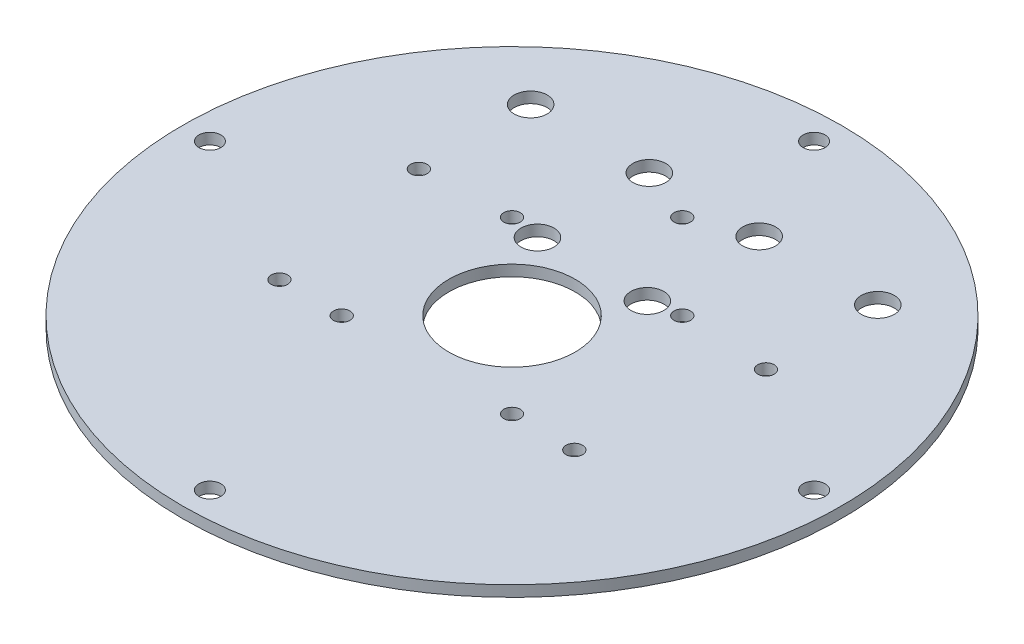
from build123d import *

# Parameters (mm, degrees)
SKETCH_1_R          = 60
SKETCH_1_R_2        = 1.5
EXTRUDE_1_DEPTH     = 2
SKETCH_3_R          = 11.5
CUT_EXTRUDE_3_DEPTH = 2
SKETCH_4_R          = 1.5
CUT_EXTRUDE_4_DEPTH = 2
SKETCH_5_R          = 3
CUT_EXTRUDE_5_DEPTH = 10
SKETCH_6_R          = 2
CUT_EXTRUDE_6_DEPTH = 10
SKETCH_7_R          = 3
CUT_EXTRUDE_7_DEPTH = 10
SKETCH_8_R          = 3
CUT_EXTRUDE_8_DEPTH = 10
SKETCH_9_R          = 1.5
CUT_EXTRUDE_9_DEPTH = 10


with BuildPart() as part:
    # 草图1 → 凸台-拉伸1 (new body)
    with BuildSketch(Plane(origin=(0, 0, 0), x_dir=(1, 0, 0), z_dir=(0, 1, 0))):
        Circle(SKETCH_1_R)
        with Locations((0, 31)):
            Circle(SKETCH_1_R_2, mode=Mode.SUBTRACT)
        with Locations((26.846787517, -15.5)):
            Circle(SKETCH_1_R_2, mode=Mode.SUBTRACT)
        with Locations((-26.846787517, -15.5)):
            Circle(SKETCH_1_R_2, mode=Mode.SUBTRACT)
    extrude(amount=EXTRUDE_1_DEPTH)

    # 草图3 → 切除-拉伸3 (cut)
    with BuildSketch(Plane(origin=(0, 2, 0), x_dir=(1, 0, 0), z_dir=(0, 1, 0))):
        Circle(SKETCH_3_R)
    extrude(amount=-CUT_EXTRUDE_3_DEPTH, mode=Mode.SUBTRACT)

    # 草图4 → 切除-拉伸4 (cut)
    with BuildSketch(Plane(origin=(0, 2, 0), x_dir=(1, 0, 0), z_dir=(0, 1, 0))):
        with Locations((-15.5, 15.5)):
            Circle(SKETCH_4_R)
        with Locations((15.5, 15.5)):
            Circle(SKETCH_4_R)
        with Locations((15.5, -15.5)):
            Circle(SKETCH_4_R)
        with Locations((-15.5, -15.5)):
            Circle(SKETCH_4_R)
    extrude(amount=-CUT_EXTRUDE_4_DEPTH, mode=Mode.SUBTRACT)

    # 草图5 → 切除-拉伸5 (cut)
    with BuildSketch(Plane.XZ):
        with Locations((10, -14.64)):
            Circle(SKETCH_5_R)
        with Locations((-10, -14.64)):
            Circle(SKETCH_5_R)
    extrude(amount=-CUT_EXTRUDE_5_DEPTH, mode=Mode.SUBTRACT)

    # 草图6 → 切除-拉伸6 (cut)
    with BuildSketch(Plane.XZ):
        with Locations((0, 55)):
            Circle(SKETCH_6_R)
        with Locations((55, 0)):
            Circle(SKETCH_6_R)
        with Locations((0, -55)):
            Circle(SKETCH_6_R)
        with Locations((-55, 0)):
            Circle(SKETCH_6_R)
    extrude(amount=-CUT_EXTRUDE_6_DEPTH, mode=Mode.SUBTRACT)

    # 草图7 → 切除-拉伸7 (cut)
    with BuildSketch(Plane.XZ):
        with Locations((10, -35)):
            Circle(SKETCH_7_R)
        with Locations((-10, -35)):
            Circle(SKETCH_7_R)
    extrude(amount=-CUT_EXTRUDE_7_DEPTH, mode=Mode.SUBTRACT)

    # 草图8 → 切除-拉伸8 (cut)
    with BuildSketch(Plane.XZ):
        with Locations((31.6, -35)):
            Circle(SKETCH_8_R)
        with Locations((-31.6, -35)):
            Circle(SKETCH_8_R)
    extrude(amount=-CUT_EXTRUDE_8_DEPTH, mode=Mode.SUBTRACT)

    # 草图9 → 切除-拉伸9 (cut)
    with BuildSketch(Plane.XZ):
        with Locations((-31.6, -14.64)):
            Circle(SKETCH_9_R)
        with Locations((31.6, -14.64)):
            Circle(SKETCH_9_R)
    extrude(amount=-CUT_EXTRUDE_9_DEPTH, mode=Mode.SUBTRACT)


solid = part.part
